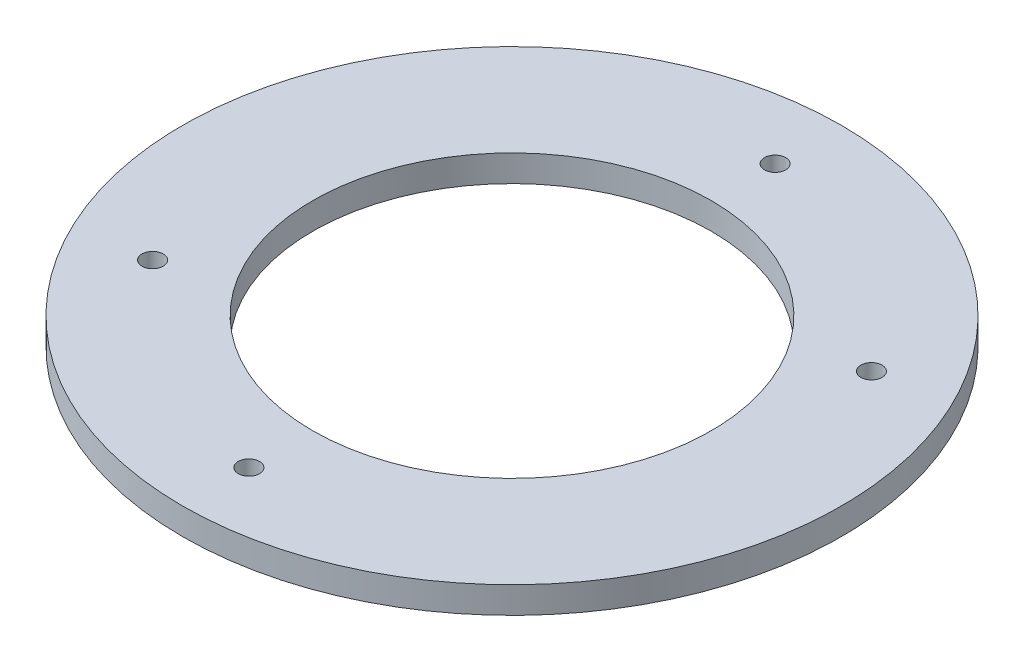
from build123d import *

# Parameters (mm, degrees)
SKETCH1_R               = 62
BOSS_EXTRUDE1_DEPTH     = 5
SKETCH2_R               = 2
CUT_EXTRUDE1_DEPTH      = 5
CIRPATTERN1_COUNT       = 2
CIRPATTERN1_ANGLE       = 120
MIRROR1_COPY_1_SKETCH_R = 2
MIRROR1_COPY_1_DEPTH    = 5
SKETCH5_R               = 37.5
CUT_EXTRUDE2_DEPTH      = 10


with BuildPart() as part:
    # Sketch1 → Boss-Extrude1 (new body)
    with BuildSketch(Plane(origin=(0, 0, 0), x_dir=(1, 0, 0), z_dir=(0, 1, 0))):
        Circle(SKETCH1_R)
    extrude(amount=BOSS_EXTRUDE1_DEPTH)

    # Sketch2 → Cut-Extrude1 (cut)
    with BuildSketch(Plane(origin=(0, 5, 0), x_dir=(1, 0, 0), z_dir=(0, 1, 0))):
        with Locations((0, 49.5)):
            Circle(SKETCH2_R)
    cut_extrude1 = extrude(amount=-CUT_EXTRUDE1_DEPTH, mode=Mode.SUBTRACT)

    # CirPattern1: Cut-Extrude1 ×2 about axis
    cirpattern1_axis = Axis((0, 5, 0), (0, 1, 0))
    for i in range(1, CIRPATTERN1_COUNT):
        add(cut_extrude1.rotate(cirpattern1_axis, i * CIRPATTERN1_ANGLE / (CIRPATTERN1_COUNT - 1)), mode=Mode.SUBTRACT)

    # Mirror1: Cut-Extrude1 across plane
    add(cut_extrude1.mirror(Plane(origin=(0, 0, 0), x_dir=(-0.49999999999999806, 0, 0.8660254037844398), z_dir=(-0.8660254037844398, 0, -0.49999999999999806))), mode=Mode.SUBTRACT)

    # Mirror1 copy 1 sketch → Mirror1 copy 1 (cut)
    with BuildSketch(Plane(origin=(0, 5, 0), x_dir=(1, 0, 0), z_dir=(0, 1, 0))):
        with Locations((0, -49.5)):
            Circle(MIRROR1_COPY_1_SKETCH_R)
    extrude(amount=-MIRROR1_COPY_1_DEPTH, mode=Mode.SUBTRACT)

    # Sketch5 → Cut-Extrude2 (cut)
    with BuildSketch(Plane.XZ):
        Circle(SKETCH5_R)
    extrude(amount=-CUT_EXTRUDE2_DEPTH, mode=Mode.SUBTRACT)


solid = part.part
